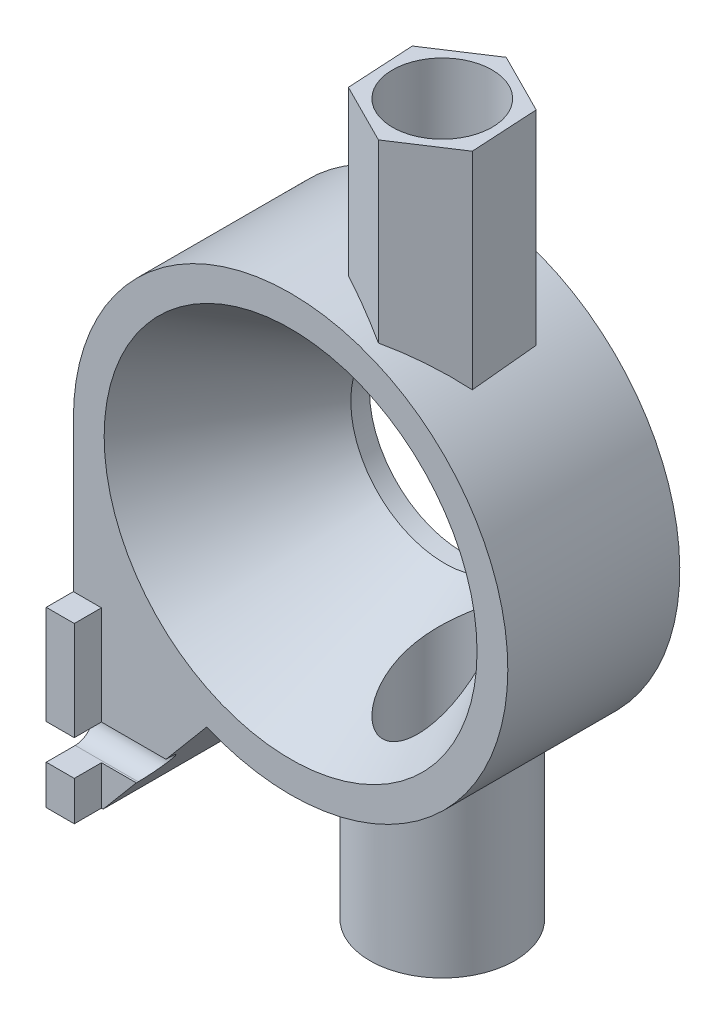
from build123d import *
from build123d.topology import SkipClean

# Parameters (mm, degrees)
SKETCH3_R            = 24
BOSS_EXTRUDE1_DEPTH  = 19
BOSS_EXTRUDE2_DEPTH  = 19
SKETCH7_R            = 8
BOSS_EXTRUDE3_DEPTH  = 22.5
BOSS_EXTRUDE4_DEPTH  = 26
SKETCH9_W            = 3
SKETCH9_H            = 19.17
BOSS_EXTRUDE5_DEPTH  = 3.1
CUT_EXTRUDE1_DEPTH   = 15
SKETCH15_R           = 21.7
CUT_EXTRUDE3_DEPTH   = 2
SKETCH17_R           = 12.95
SKETCH17_R_2         = 10.35
BOSS_EXTRUDE9_DEPTH  = 2.06
SKETCH24_R           = 5.5
CUT_EXTRUDE5_DEPTH   = 263.006202312
BOSS_EXTRUDE11_START = 1.5
BOSS_EXTRUDE11_DEPTH = 1.5


with BuildPart() as part:
    # Sketch3 → Boss-Extrude1 (new body)
    with BuildSketch(Plane.XY):
        with Locations((225, 142.5)):
            Circle(SKETCH3_R)
    extrude(amount=BOSS_EXTRUDE1_DEPTH)

    # Sketch5 → Boss-Extrude2 (add)
    with BuildSketch(Plane.XY):
        with BuildLine():
            Line((201, 142.5), (201, 106.774519899))
            Line((201, 106.774519899), (204.286593584, 106.774519899))
            Line((204.286593584, 106.774519899), (215.733540757, 120.361058447))
            ThreePointArc((215.733540757, 120.361058447), (205.020072299, 129.203290291), (201, 142.5))
        make_face()
    extrude(amount=BOSS_EXTRUDE2_DEPTH)

    # Sketch7 → Boss-Extrude3 (add)
    with BuildSketch(Plane(origin=(0, 128.5, 0), x_dir=(-1, 0, 0), z_dir=(0, -1, 0))):
        with Locations((-232.76, -10)):
            Circle(SKETCH7_R)
    extrude(amount=BOSS_EXTRUDE3_DEPTH)

    # Sketch8 → Boss-Extrude4 (add)
    with BuildSketch(Plane(origin=(0, 158.5, 0), x_dir=(-1, 0, 0), z_dir=(0, -1, 0))):
        Polygon((-239.027907652, -5.894705912), (-239.449242796, -13.375520211), (-233.181335144, -17.480814299), (-226.492092348, -14.105294088), (-226.070757204, -6.624479789), (-232.338664856, -2.519185701), align=None)
    extrude(amount=-BOSS_EXTRUDE4_DEPTH)

    # Sketch9 → Boss-Extrude5 (add)
    with BuildSketch(Plane.ZY.offset(-201)):
        with Locations((20.5, 116.359519899)):
            Rectangle(SKETCH9_W, SKETCH9_H)
    extrude(amount=-BOSS_EXTRUDE5_DEPTH)

    # Sketch10 → Cut-Extrude1 (cut)
    with BuildSketch(Plane.ZY.offset(-201)):
        with BuildLine():
            Line((0, 115.014519899), (0, 111.124519899))
            Line((0, 111.124519899), (3.205, 111.124519899))
            ThreePointArc((3.205, 111.124519899), (5.15, 113.069519899), (3.205, 115.014519899))
            Line((3.205, 115.014519899), (0, 115.014519899))
        make_face()
        with BuildLine():
            Line((22, 111.124519899), (22, 115.014519899))
            Line((22, 115.014519899), (18.795, 115.014519899))
            ThreePointArc((18.795, 115.014519899), (16.85, 113.069519899), (18.795, 111.124519899))
            Line((18.795, 111.124519899), (22, 111.124519899))
        make_face()
    extrude(amount=-CUT_EXTRUDE1_DEPTH, mode=Mode.SUBTRACT)

    # Sketch15 → Cut-Extrude3 (cut)
    with BuildSketch(Plane(origin=(0, 0, 0), x_dir=(-1, 0, 0), z_dir=(0, 0, -1))):
        with Locations((-225, 142.5)):
            Circle(SKETCH15_R)
    extrude(amount=-CUT_EXTRUDE3_DEPTH, mode=Mode.SUBTRACT)

    # Sketch17 → Boss-Extrude9 (add)
    with BuildSketch(Plane(origin=(0, 0, 2), x_dir=(-1, 0, 0), z_dir=(0, 0, -1))):
        with Locations((-225, 142.5)):
            Circle(SKETCH17_R)
        with Locations((-225, 142.5)):
            Circle(SKETCH17_R_2, mode=Mode.SUBTRACT)
    extrude(amount=BOSS_EXTRUDE9_DEPTH)

    # Sketch21 → Cut-Revolve2 (revolve, cut)
    with BuildSketch(Plane(origin=(225, 0, 0), x_dir=(0, 0, -1), z_dir=(1, 0, 0))):
        Polygon((-19, 163.1), (-19, 142.5), (-2, 142.5), (-2, 152.85), align=None)
    revolve(axis=Axis((225, 142.5, 19), (0, 0, -1)), mode=Mode.SUBTRACT)

    # Sketch24 → Cut-Extrude5 (cut, through all)
    with BuildSketch(Plane.XZ.offset(-106)):
        with Locations((232.76, 10)):
            Circle(SKETCH24_R)
    extrude(amount=-CUT_EXTRUDE5_DEPTH, mode=Mode.SUBTRACT)

    # Sketch27 → Boss-Extrude11 (add)
    with SkipClean():  # the faces are left unmerged after this step: merging them gives an invalid solid
        with BuildSketch(Plane(origin=(0, 0, 0), x_dir=(-1, 0, 0), z_dir=(0, 0, -1)).offset(BOSS_EXTRUDE11_START)):
            with BuildLine():
                Line((-220.76403261, 163.782541678), (-220.315059108, 166.038294943))
                ThreePointArc((-220.315059108, 166.038294943), (-222.518656103, 166.371383128), (-224.743649465, 166.498630886))
                Line((-224.743649465, 166.498630886), (-224.768216391, 164.198762093))
                ThreePointArc((-224.768216391, 164.198762093), (-222.75645156, 164.083708912), (-220.76403261, 163.782541678))
            make_face()
            with BuildLine():
                Line((-221.263202546, 121.124164466), (-220.867136457, 118.858522911))
                ThreePointArc((-220.867136457, 118.858522911), (-223.076933348, 118.577169594), (-225.303297867, 118.501916526))
                Line((-225.303297867, 118.501916526), (-225.274231821, 120.801732859))
                ThreePointArc((-225.274231821, 120.801732859), (-223.261227236, 120.869774174), (-221.263202546, 121.124164466))
            make_face()
        extrude(amount=-BOSS_EXTRUDE11_DEPTH)


solid = part.part
